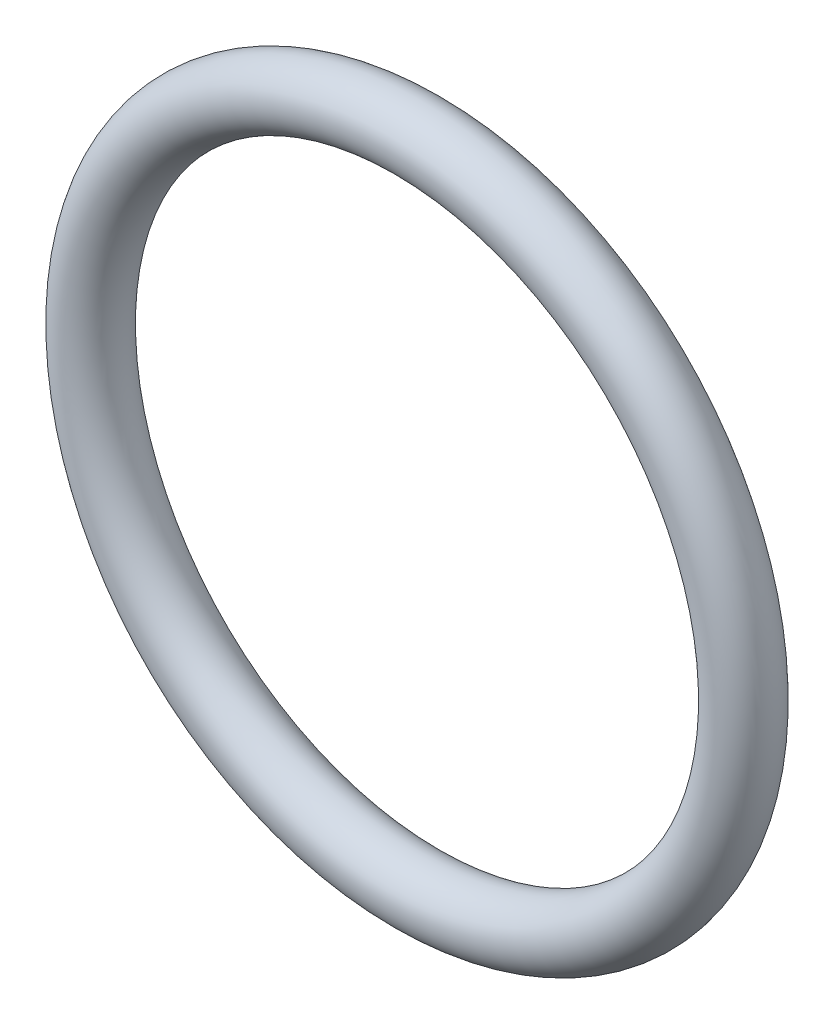
from build123d import *

# Parameters (mm, degrees)
CROQUIS1_R = 1.2


# Read off the part's stored shape, not the designer's step: Sólido importado2
with BuildPart() as part:
    # Croquis1 → Revolución1 (revolve)
    with BuildSketch(Plane(origin=(0, 0, 0), x_dir=(1, 0, 0), z_dir=(0, 1, 0)), mode=Mode.PRIVATE) as revoluci_n1_sk:
        with Locations((12.35, 0)):
            Circle(CROQUIS1_R)
    revolve(revoluci_n1_sk.sketch.rotate(Axis((0, 0, -1.2), (0, 0, 1)), 90), axis=Axis((0, 0, -1.2), (0, 0, 1)))


solid = part.part
